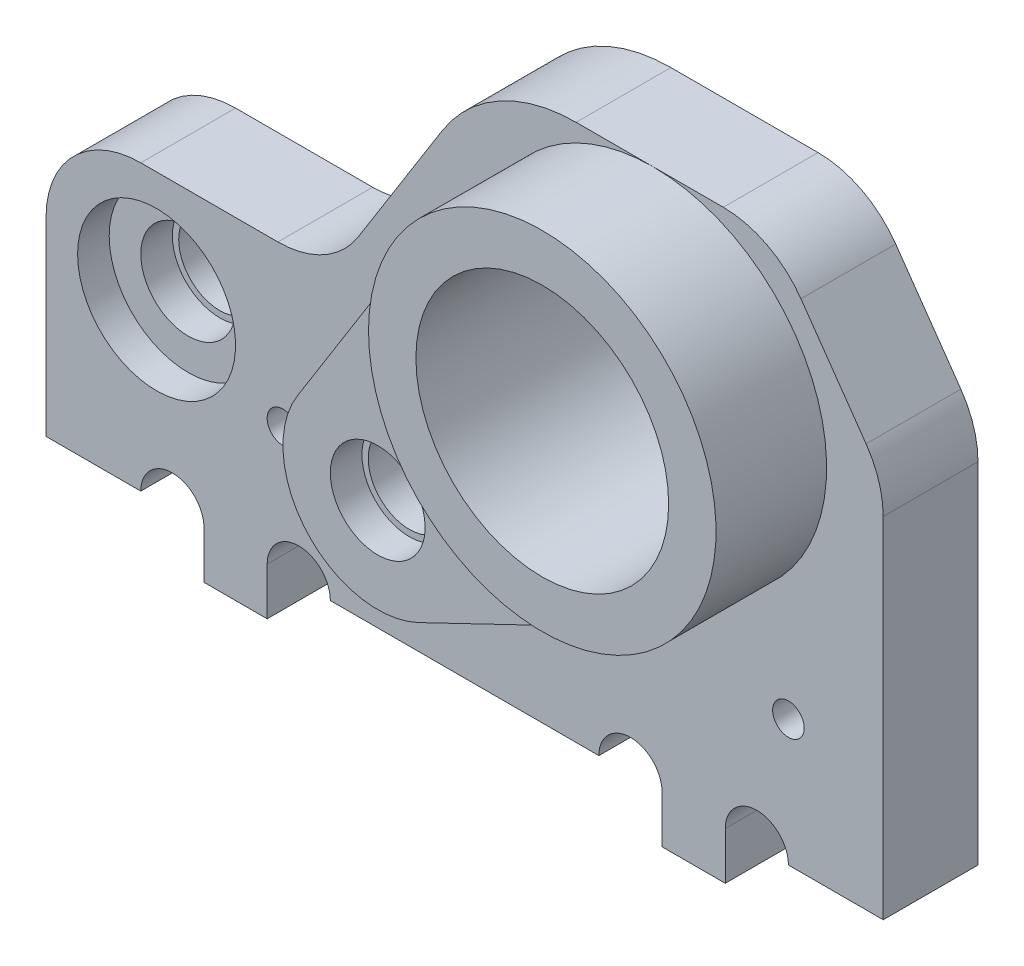
from build123d import *
from build123d.topology import SkipClean

# Parameters (mm, degrees)
SKETCH1_W                            = 26.5
SKETCH1_H                            = 6
BOSS_EXTRUDE1_DEPTH                  = 17
SKETCH2_R                            = 1.5
CUT_EXTRUDE1_DEPTH                   = 1
SKETCH3_R                            = 1.3
CUT_EXTRUDE2_DEPTH                   = 32.878676259
SKETCH4_R                            = 4
CUT_EXTRUDE3_DEPTH                   = 33.050741021
SKETCH5_R                            = 2.5
CUT_EXTRUDE4_DEPTH                   = 1.5
SKETCH6_R                            = 1.5
CUT_EXTRUDE8_DEPTH                   = 1
SKETCH7_R                            = 1.3
CUT_EXTRUDE9_DEPTH                   = 32.678068123
CUT_EXTRUDE10_START                  = -1
SKETCH8_R                            = 2.5
CUT_EXTRUDE10_DEPTH                  = 1
CUT_EXTRUDE11_START                  = -1
SKETCH9_R                            = 1.5
CUT_EXTRUDE11_DEPTH                  = 1
SKETCH10_R                           = 5.5
SKETCH10_R_2                         = 4
BOSS_EXTRUDE2_DEPTH                  = 3.5
SKETCH11_R                           = 3
SKETCH11_R_2                         = 1.3
BOSS_EXTRUDE4_DEPTH                  = 2
CUT_EXTRUDE12_START                  = -1
SKETCH12_R                           = 1.5
CUT_EXTRUDE12_DEPTH                  = 1
SKETCH17_W                           = 2
SKETCH17_H                           = 6
BOSS_EXTRUDE6_DEPTH                  = 1.5
SKETCH18_R                           = 1
CUT_EXTRUDE17_DEPTH                  = 33.050741021
CHAMFER2_SIZE                        = 5
CHAMFER2_SIZE2                       = 3.5
FILLET11_R                           = 3
BOSS_EXTRUDE7_DEPTH                  = 2
CUT_EXTRUDE19_DEPTH                  = 33.050741021
FILLET13_R                           = 5
FILLET14_R                           = 3
FILLET15_R                           = 3
SKIZZE1_R                            = 0.5
SCHNITT_LINEAR_AUSTRAGEN1_DEPTH      = 33.050741021
SPIEGELN1_OUTLINE_R                  = 4
SPIEGELN1_OUTLINE_R_2                = 2.5
SPIEGELN1_OUTLINE_R_3                = 0.5
SPIEGELN1_OUTLINE_R_4                = 1.5
SPIEGELN1_DEPTH                      = 6
SPIEGELN1_START                      = 6
SPIEGELN1_2_OUTLINE_R                = 4
SPIEGELN1_2_OUTLINE_R_2              = 1.5
SPIEGELN1_2_DEPTH                    = 2
SPIEGELN1_START_2                    = 8
SPIEGELN1_3_OUTLINE_R                = 5.5
SPIEGELN1_3_OUTLINE_R_2              = 4
SPIEGELN1_3_DEPTH                    = 1.5
SPIEGELN1_START_3                    = 1.5
SPIEGELN1_4_OUTLINE_R                = 1.5
SPIEGELN1_4_OUTLINE_R_2              = 1.3
SPIEGELN1_4_OUTLINE_R_3              = 2.5
SPIEGELN1_4_DEPTH                    = 3.5
SPIEGELN1_START_4                    = 1
SPIEGELN1_5_OUTLINE_R                = 1.5
SPIEGELN1_5_OUTLINE_R_2              = 1.3
SPIEGELN1_5_DEPTH                    = 6
SPIEGELN1_START_5                    = 2.5
SPIEGELN1_6_OUTLINE_R                = 1.5
SPIEGELN1_6_OUTLINE_R_2              = 1.3
SPIEGELN1_6_DEPTH                    = 1.5
SCHNITT_LINEAR_AUSTRAGEN2_DEPTH      = 31.409702399
SCHNITT_LINEAR_AUSTRAGEN2_DEPTH_BACK = 31.409702399
SKIZZE2_W                            = 26.5
SKIZZE2_H                            = 9.5
SCHNITT_LINEAR_AUSTRAGEN3_DEPTH      = 31.409702399
SCHNITT_LINEAR_AUSTRAGEN3_DEPTH_BACK = 31.409702399
SKIZZE3_W                            = 26.5
SKIZZE3_H                            = 3


# Read off the part's stored shape, not the designer's step: Spiegeln1
with BuildPart() as part:
    # Sketch1 → Boss-Extrude1 (new body)
    with BuildSketch(Plane(origin=(0, 0, 0), x_dir=(1, 0, 0), z_dir=(0, 1, 0))):
        with Locations((13.25, 3)):
            Rectangle(SKETCH1_W, SKETCH1_H)
    extrude(amount=BOSS_EXTRUDE1_DEPTH)

    # Sketch2 → Cut-Extrude1 (cut)
    with BuildSketch(Plane.XY):
        with Locations((12.5, 5.5)):
            Circle(SKETCH2_R)
    extrude(amount=-CUT_EXTRUDE1_DEPTH, mode=Mode.SUBTRACT)

    # Sketch3 → Cut-Extrude2 (cut, through all)
    with BuildSketch(Plane.XY.offset(-1)):
        with Locations((12.5, 5.5)):
            Circle(SKETCH3_R)
    extrude(amount=-CUT_EXTRUDE2_DEPTH, mode=Mode.SUBTRACT)

    # Sketch4 → Cut-Extrude3 (cut, through all)
    with BuildSketch(Plane.XY):
        with Locations((19.208203932, 11.5)):
            Circle(SKETCH4_R)
    extrude(amount=-CUT_EXTRUDE3_DEPTH, mode=Mode.SUBTRACT)

    # Sketch5 → Cut-Extrude4 (cut)
    with BuildSketch(Plane.XY):
        with Locations((3.5, 5.5)):
            Circle(SKETCH5_R)
    extrude(amount=-CUT_EXTRUDE4_DEPTH, mode=Mode.SUBTRACT)

    # Sketch6 → Cut-Extrude8 (cut)
    with BuildSketch(Plane.XY.offset(-1.5)):
        with Locations((3.5, 5.5)):
            Circle(SKETCH6_R)
    extrude(amount=-CUT_EXTRUDE8_DEPTH, mode=Mode.SUBTRACT)

    # Sketch7 → Cut-Extrude9 (cut, through all)
    with BuildSketch(Plane.XY.offset(-2.5)):
        with Locations((3.5, 5.5)):
            Circle(SKETCH7_R)
    extrude(amount=-CUT_EXTRUDE9_DEPTH, mode=Mode.SUBTRACT)

    # Sketch8 → Cut-Extrude10 (cut)
    with BuildSketch(Plane(origin=(0, 0, -6), x_dir=(-1, 0, 0), z_dir=(0, 0, -1)).offset(CUT_EXTRUDE10_START)):
        with Locations(Location((-3.5, 5.5, 0), (0, 0, 180))):
            Circle(SKETCH8_R)
    extrude(amount=CUT_EXTRUDE10_DEPTH, mode=Mode.SUBTRACT)

    # Sketch9 → Cut-Extrude11 (cut)
    with BuildSketch(Plane(origin=(0, 0, -5), x_dir=(-1, 0, 0), z_dir=(0, 0, -1)).offset(CUT_EXTRUDE11_START)):
        with Locations(Location((-3.5, 5.5, 0), (0, 0, 180))):
            Circle(SKETCH9_R)
    extrude(amount=CUT_EXTRUDE11_DEPTH, mode=Mode.SUBTRACT)

    # Sketch10 → Boss-Extrude2 (add)
    with BuildSketch(Plane(origin=(0, 0, -6), x_dir=(-1, 0, 0), z_dir=(0, 0, -1))):
        with Locations(Location((-19.208203932, 11.5, 0), (0, 0, 90))):
            Circle(SKETCH10_R)
        with Locations(Location((-19.208203932, 11.5, 0), (0, 0, 180))):
            Circle(SKETCH10_R_2, mode=Mode.SUBTRACT)
    extrude(amount=BOSS_EXTRUDE2_DEPTH)

    # Sketch11 → Boss-Extrude4 (add)
    with BuildSketch(Plane(origin=(0, 0, -6), x_dir=(-1, 0, 0), z_dir=(0, 0, -1))):
        with Locations(Location((-12.5, 5.5, 0), (0, 0, 180))):
            Circle(SKETCH11_R)
        with Locations(Location((-12.5, 5.5, 0), (0, 0, 180))):
            Circle(SKETCH11_R_2, mode=Mode.SUBTRACT)
    extrude(amount=BOSS_EXTRUDE4_DEPTH)

    # Sketch12 → Cut-Extrude12 (cut)
    with BuildSketch(Plane(origin=(0, 0, -8), x_dir=(-1, 0, 0), z_dir=(0, 0, -1)).offset(CUT_EXTRUDE12_START)):
        with Locations(Location((-12.5, 5.5, 0), (0, 0, 180))):
            Circle(SKETCH12_R)
    extrude(amount=CUT_EXTRUDE12_DEPTH, mode=Mode.SUBTRACT)

    # Sketch17 → Boss-Extrude6 (add)
    with BuildSketch(Plane.XZ):
        with Locations((6, -3)):
            Rectangle(SKETCH17_W, SKETCH17_H)
        with Locations((20.5, -3)):
            Rectangle(SKETCH17_W, SKETCH17_H)
    extrude(amount=BOSS_EXTRUDE6_DEPTH)

    # Sketch18 → Cut-Extrude17 (cut, through all)
    with BuildSketch(Plane(origin=(0, 0, -6), x_dir=(-1, 0, 0), z_dir=(0, 0, -1))):
        with Locations((-22.5, 0)):
            Circle(SKETCH18_R)
        with Locations((-18.5, 0)):
            Circle(SKETCH18_R)
        with Locations((-8, 0)):
            Circle(SKETCH18_R)
        with Locations((-4, 0)):
            Circle(SKETCH18_R)
    extrude(amount=-CUT_EXTRUDE17_DEPTH, mode=Mode.SUBTRACT)

    # Chamfer2
    chamfer2_edges = [part.edges().sort_by_distance(p)[0] for p in [
        (26.5, 17, -3),
    ]]
    chamfer2_side = [part.faces().sort_by_distance(p)[0] for p in [
        (26.5, 8.5, -3),
    ]]
    chamfer(chamfer2_edges, length=CHAMFER2_SIZE, length2=CHAMFER2_SIZE2, reference=chamfer2_side[0])

    # Fillet11
    fillet11_edges = [part.edges().sort_by_distance(p)[0] for p in [
        (23, 17, -3),
        (26.5, 12, -3),
    ]]
    fillet(fillet11_edges, radius=FILLET11_R)

    # Sketch19 → Boss-Extrude7 (add)
    with BuildSketch(Plane(origin=(0, 0, -6), x_dir=(-1, 0, 0), z_dir=(0, 0, -1))):
        with BuildLine():
            Line((-14.547099294, 14.419606745), (-9.957579288, 7.09251277))
            ThreePointArc((-9.957579288, 7.09251277), (-14.736067977, 7.5), (-13.800160725, 2.796376119))
            Line((-13.800160725, 2.796376119), (-21.591831928, 6.543356218))
            ThreePointArc((-21.591831928, 6.543356218), (-15.108745974, 7.833333333), (-14.547099294, 14.419606745))
        make_face()
    extrude(amount=BOSS_EXTRUDE7_DEPTH)

    # Sketch20 → Cut-Extrude19 (cut, through all)
    with BuildSketch(Plane(origin=(0, 0, -6), x_dir=(-1, 0, 0), z_dir=(0, 0, -1))):
        Polygon((0, 17), (-14.011012575, 17), (-9, 9), (0, 9), align=None)
    extrude(amount=-CUT_EXTRUDE19_DEPTH, mode=Mode.SUBTRACT)

    # Fillet13
    fillet13_edges = [part.edges().sort_by_distance(p)[0] for p in [
        (14.011012575, 17, -3),
    ]]
    fillet(fillet13_edges, radius=FILLET13_R)

    # Fillet14
    fillet14_edges = [part.edges().sort_by_distance(p)[0] for p in [
        (9, 9, -3),
    ]]
    fillet(fillet14_edges, radius=FILLET14_R)

    # Fillet15
    fillet15_edges = [part.edges().sort_by_distance(p)[0] for p in [
        (0, 9, -3),
    ]]
    fillet(fillet15_edges, radius=FILLET15_R)

    # Skizze1 → Schnitt-Linear austragen1 (cut, through all)
    with BuildSketch(Plane(origin=(0, 0, -6), x_dir=(-1, 0, 0), z_dir=(0, 0, -1))):
        with Locations((-23.5, 4)):
            Circle(SKIZZE1_R)
        with Locations((-7.5, 4)):
            Circle(SKIZZE1_R)
    extrude(amount=-SCHNITT_LINEAR_AUSTRAGEN1_DEPTH, mode=Mode.SUBTRACT)

    # Spiegeln1 outline → Spiegeln1 (add)
    with SkipClean():  # the faces are left unmerged after this step: merging them gives an invalid solid
        with BuildSketch(Plane.XY):
            with BuildLine():
                Line((21.438033315, 17), (16.779018718, 17))
                ThreePointArc((16.779018718, 17), (14.357339523, 16.374410803), (12.541650865, 14.65418795))
                Line((12.541650865, 14.65418795), (9.881617026, 10.40748723))
                ThreePointArc((9.881617026, 10.40748723), (8.792203831, 9.375353518), (7.339196314, 9))
                Line((7.339196314, 9), (3, 9))
                ThreePointArc((3, 9), (0.878679656, 8.121320344), (0, 6))
                Line((0, 6), (0, 0))
                Line((0, 0), (3, 0))
                ThreePointArc((3, 0), (4, 1), (5, 0))
                Line((5, 0), (5, -1.5))
                Line((5, -1.5), (7, -1.5))
                Line((7, -1.5), (7, 0))
                ThreePointArc((7, 0), (8, 1), (9, 0))
                Line((9, 0), (17.5, 0))
                ThreePointArc((17.5, 0), (18.5, 1), (19.5, 0))
                Line((19.5, 0), (19.5, -1.5))
                Line((19.5, -1.5), (21.5, -1.5))
                Line((21.5, -1.5), (21.5, 0))
                ThreePointArc((21.5, 0), (22.5, 1), (23.5, 0))
                Line((23.5, 0), (26.5, 0))
                Line((26.5, 0), (26.5, 11.054333308))
                ThreePointArc((26.5, 11.054333308), (26.361213666, 11.956251462), (25.957695762, 12.774720341))
                Line((25.957695762, 12.774720341), (23.895729077, 15.720387033))
                ThreePointArc((23.895729077, 15.720387033), (22.823464458, 16.660936029), (21.438033315, 17))
            make_face()
            with Locations((19.208203932, 11.5)):
                Circle(SPIEGELN1_OUTLINE_R, mode=Mode.SUBTRACT)
            with Locations((3.5, 5.5)):
                Circle(SPIEGELN1_OUTLINE_R_2, mode=Mode.SUBTRACT)
            with Locations((7.5, 4)):
                Circle(SPIEGELN1_OUTLINE_R_3, mode=Mode.SUBTRACT)
            with Locations((23.5, 4)):
                Circle(SPIEGELN1_OUTLINE_R_3, mode=Mode.SUBTRACT)
            with Locations((12.5, 5.5)):
                Circle(SPIEGELN1_OUTLINE_R_4, mode=Mode.SUBTRACT)
        extrude(amount=SPIEGELN1_DEPTH)

    # Spiegeln1 2 outline → Spiegeln1 2 (add)
    with SkipClean():  # the faces are left unmerged after this step: merging them gives an invalid solid
        with BuildSketch(Plane.XY.offset(SPIEGELN1_START)):
            with BuildLine():
                Line((14.547099293, 14.419606745), (9.957579288, 7.09251277))
                ThreePointArc((9.957579288, 7.09251277), (10.263932023, 3.5), (13.800160725, 2.796376119))
                Line((13.800160725, 2.796376119), (21.591831928, 6.543356218))
                ThreePointArc((21.591831928, 6.543356218), (23.307661891, 15.166666667), (14.547099293, 14.419606745))
            make_face()
            with Locations((19.208203932, 11.5)):
                Circle(SPIEGELN1_2_OUTLINE_R, mode=Mode.SUBTRACT)
            with Locations((12.5, 5.5)):
                Circle(SPIEGELN1_2_OUTLINE_R_2, mode=Mode.SUBTRACT)
        extrude(amount=SPIEGELN1_2_DEPTH)

    # Spiegeln1 3 outline → Spiegeln1 3 (add)
    with SkipClean():  # the faces are left unmerged after this step: merging them gives an invalid solid
        with BuildSketch(Plane.XY.offset(SPIEGELN1_START_2)):
            with Locations((19.208203932, 11.5)):
                Circle(SPIEGELN1_3_OUTLINE_R)
            with Locations((19.208203932, 11.5)):
                Circle(SPIEGELN1_3_OUTLINE_R_2, mode=Mode.SUBTRACT)
        extrude(amount=SPIEGELN1_3_DEPTH)

    # Spiegeln1 4 outline → Spiegeln1 4 (add)
    # profile 1 of 2: a face of its own
    with SkipClean():  # the faces are left unmerged after this step: merging them gives an invalid solid
        with BuildSketch(Plane.XY.offset(SPIEGELN1_START_3)):
            with Locations((12.5, 5.5)):
                Circle(SPIEGELN1_4_OUTLINE_R)
            with Locations((12.5, 5.5)):
                Circle(SPIEGELN1_4_OUTLINE_R_2, mode=Mode.SUBTRACT)
        # profile 2 of 2: a face of its own
        with BuildSketch(Plane.XY.offset(SPIEGELN1_START_3)):
            with Locations((3.5, 5.5)):
                Circle(SPIEGELN1_4_OUTLINE_R_3)
            with Locations((3.5, 5.5)):
                Circle(SPIEGELN1_4_OUTLINE_R, mode=Mode.SUBTRACT)
        extrude(amount=SPIEGELN1_4_DEPTH)

    # Spiegeln1 5 outline → Spiegeln1 5 (add)
    with SkipClean():  # the faces are left unmerged after this step: merging them gives an invalid solid
        with BuildSketch(Plane.XY.offset(SPIEGELN1_START_4)):
            with Locations((12.5, 5.5)):
                Circle(SPIEGELN1_5_OUTLINE_R)
            with Locations((12.5, 5.5)):
                Circle(SPIEGELN1_5_OUTLINE_R_2, mode=Mode.SUBTRACT)
        extrude(amount=SPIEGELN1_5_DEPTH)

    # Spiegeln1 6 outline → Spiegeln1 6 (add)
    with SkipClean():  # the faces are left unmerged after this step: merging them gives an invalid solid
        with BuildSketch(Plane.XY.offset(SPIEGELN1_START_5)):
            with Locations((3.5, 5.5)):
                Circle(SPIEGELN1_6_OUTLINE_R)
            with Locations((3.5, 5.5)):
                Circle(SPIEGELN1_6_OUTLINE_R_2, mode=Mode.SUBTRACT)
        extrude(amount=SPIEGELN1_6_DEPTH)

    # Skizze2 → Schnitt-Linear austragen2 (cut, two sides: drawn at the far end of the back side and taken through both)
    with BuildSketch(Plane(origin=(0, 5.5, 0), x_dir=(1, 0, 0), z_dir=(0, 1, 0)).offset(-SCHNITT_LINEAR_AUSTRAGEN2_DEPTH_BACK)):
        with Locations((13.25, 4.75)):
            Rectangle(SKIZZE2_W, SKIZZE2_H)
    extrude(amount=SCHNITT_LINEAR_AUSTRAGEN2_DEPTH + SCHNITT_LINEAR_AUSTRAGEN2_DEPTH_BACK, mode=Mode.SUBTRACT)

    # Skizze3 → Schnitt-Linear austragen3 (cut, two sides: drawn at the far end of the back side and taken through both)
    with BuildSketch(Plane(origin=(0, 5.5, 0), x_dir=(1, 0, 0), z_dir=(0, 1, 0)).offset(-SCHNITT_LINEAR_AUSTRAGEN3_DEPTH_BACK)):
        with Locations((13.25, -1.5)):
            Rectangle(SKIZZE3_W, SKIZZE3_H)
    extrude(amount=SCHNITT_LINEAR_AUSTRAGEN3_DEPTH + SCHNITT_LINEAR_AUSTRAGEN3_DEPTH_BACK, mode=Mode.SUBTRACT)


solid = part.part
